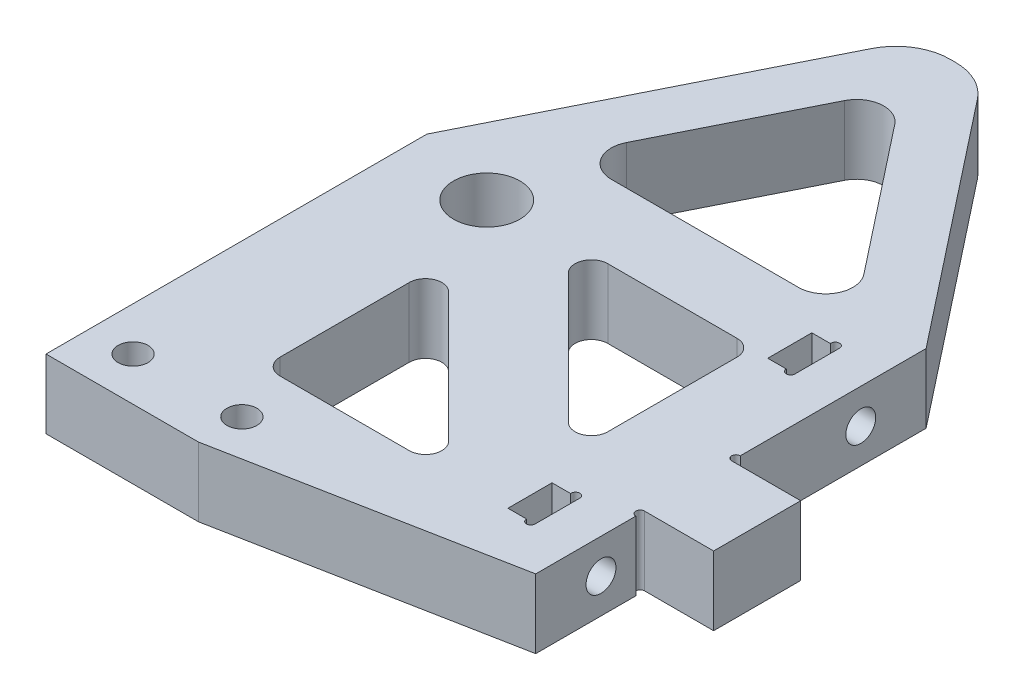
from build123d import *

# Parameters (mm, degrees)
SKETCH1_R           = 6.1
SKETCH1_R_2         = 2.75
BOSS_EXTRUDE1_DEPTH = 12.7
FILLET1_R           = 10
CUT_EXTRUDE1_DEPTH  = 145.780143666
FILLET2_R           = 5
CUT_EXTRUDE2_DEPTH  = 145.780143666
SKETCH6_R           = 2.75
CUT_EXTRUDE3_DEPTH  = 141.517934798


with BuildPart() as part:
    # Sketch1 → Boss-Extrude1 (new body)
    with BuildSketch(Plane(origin=(0, 0, 0), x_dir=(1, 0, 0), z_dir=(0, 1, 0))):
        with BuildLine():
            Line((-80, 0), (-80, 60))
            Line((-80, 60), (-50, 120))
            Line((-50, 120), (-38, 120))
            Line((-38, 120), (0, 71.75))
            Line((0, 71.75), (0, 37.6))
            ThreePointArc((0, 37.6), (-0.8, 36.8), (0, 36))
            Line((0, 36), (12.7, 36))
            Line((12.7, 36), (12.7, 20))
            Line((12.7, 20), (0, 20))
            ThreePointArc((0, 20), (-0.8, 19.2), (0, 18.4))
            Line((0, 18.4), (0, 0))
            Line((0, 0), (-52, -10))
            Line((-52, -10), (-80, -10))
            Line((-80, -10), (-80, 0))
        make_face()
        with Locations((-64, 55)):
            Circle(SKETCH1_R, mode=Mode.SUBTRACT)
        with Locations((-72, -2)):
            Circle(SKETCH1_R_2, mode=Mode.SUBTRACT)
        with Locations((-52, -2)):
            Circle(SKETCH1_R_2, mode=Mode.SUBTRACT)
    extrude(amount=BOSS_EXTRUDE1_DEPTH)

    # Fillet1
    fillet1_edges = [part.edges().sort_by_distance(p)[0] for p in [
        (-38, 6.35, -120),
        (-50, 6.35, -120),
    ]]
    fillet(fillet1_edges, radius=FILLET1_R)

    # Sketch3 → Cut-Extrude1 (cut, through all)
    with BuildSketch(Plane(origin=(0, 12.7, 0), x_dir=(1, 0, 0), z_dir=(0, 1, 0))):
        Polygon((-11.153807036, 69.75), (-43.4443892, 110.750541826), (-63.944660113, 69.75), align=None)
        with BuildLine():
            Line((-58, 34.757359313), (-58, 11))
            ThreePointArc((-58, 11), (-57.121320344, 8.878679656), (-55, 8))
            Line((-55, 8), (-31.242640687, 8))
            ThreePointArc((-31.242640687, 8), (-28.47100209, 9.851949703), (-29.121320344, 13.121320344))
            Line((-29.121320344, 13.121320344), (-52.878679656, 36.878679656))
            ThreePointArc((-52.878679656, 36.878679656), (-56.148050297, 37.52899791), (-58, 34.757359313))
        make_face()
        with BuildLine():
            Line((-16, 29.242640687), (-16, 53))
            ThreePointArc((-16, 53), (-16.878679656, 55.121320344), (-19, 56))
            Line((-19, 56), (-42.757359313, 56))
            ThreePointArc((-42.757359313, 56), (-45.52899791, 54.148050297), (-44.878679656, 50.878679656))
            Line((-44.878679656, 50.878679656), (-21.121320344, 27.121320344))
            ThreePointArc((-21.121320344, 27.121320344), (-17.851949703, 26.47100209), (-16, 29.242640687))
        make_face()
    extrude(amount=-CUT_EXTRUDE1_DEPTH, mode=Mode.SUBTRACT)

    # Fillet2
    fillet2_edges = [part.edges().sort_by_distance(p)[0] for p in [
        (-43.4443892, 6.35, -110.750541826),
        (-11.153807036, 6.35, -69.75),
        (-63.944660113, 6.35, -69.75),
    ]]
    fillet(fillet2_edges, radius=FILLET2_R)

    # Sketch4 → Cut-Extrude2 (cut, through all)
    with BuildSketch(Plane(origin=(0, 12.7, 0), x_dir=(1, 0, 0), z_dir=(0, 1, 0))):
        with BuildLine():
            Line((-13, 16), (-13, 7.9))
            Line((-13, 7.9), (-9.6, 7.9))
            ThreePointArc((-9.6, 7.9), (-8.8, 7.1), (-8, 7.9))
            Line((-8, 7.9), (-8, 16.1))
            ThreePointArc((-8, 16.1), (-8.85009833, 16.898429807), (-9.593725393, 16))
            Line((-9.593725393, 16), (-13, 16))
        make_face()
        with BuildLine():
            Line((-13, 55.65), (-9.6, 55.65))
            ThreePointArc((-9.6, 55.65), (-8.8, 54.85), (-8, 55.65))
            Line((-8, 55.65), (-8, 63.85))
            ThreePointArc((-8, 63.85), (-8.85009833, 64.648429807), (-9.593725393, 63.75))
            Line((-9.593725393, 63.75), (-13, 63.75))
            Line((-13, 63.75), (-13, 55.65))
        make_face()
    extrude(amount=-CUT_EXTRUDE2_DEPTH, mode=Mode.SUBTRACT)

    # Sketch6 → Cut-Extrude3 (cut, through all)
    with BuildSketch(Plane.ZY.offset(8)):
        with Locations((-12, 6.35)):
            Circle(SKETCH6_R)
        with Locations((-59.75, 6.35)):
            Circle(SKETCH6_R)
    extrude(amount=-CUT_EXTRUDE3_DEPTH, mode=Mode.SUBTRACT)


solid = part.part
